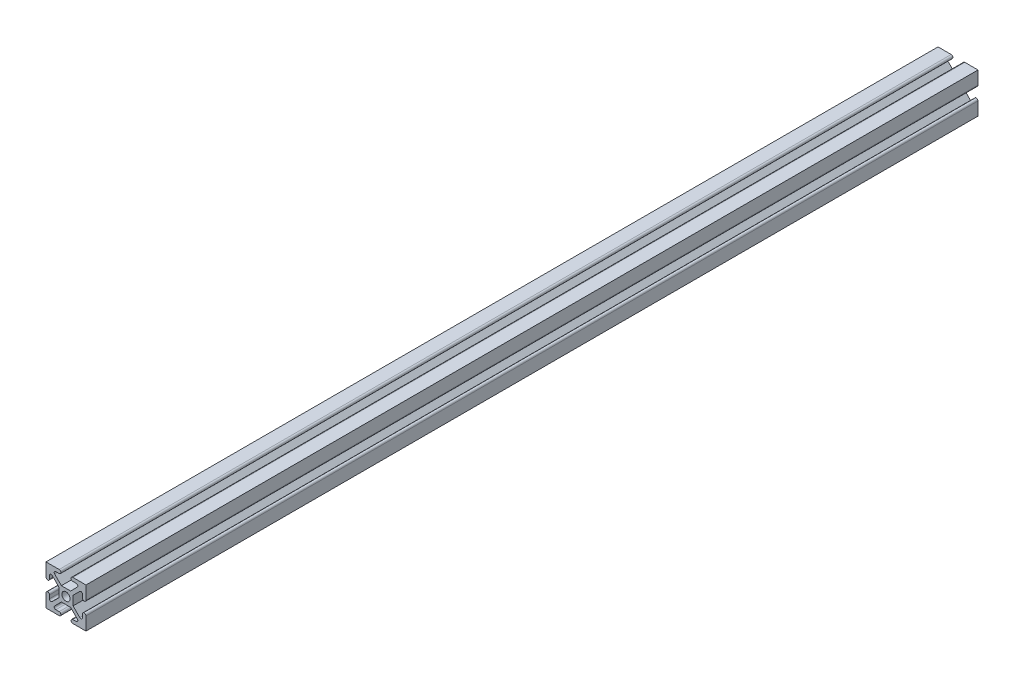
from build123d import *

# Parameters (mm, degrees)
SKETCH1_R           = 2.603515684
BOSS_EXTRUDE1_DEPTH = 566.7375


with BuildPart() as part:
    # Sketch1 → Boss-Extrude1 (new body)
    with BuildSketch(Plane.XY):
        with BuildLine():
            Line((-4.343426137, -10.490263197), (-6.474833462, -10.490263197))
            ThreePointArc((-6.474833462, -10.490263197), (-7.413500722, -9.863065786), (-7.19325828, -8.755832258))
            Line((-7.19325828, -8.755832258), (-2.933253106, -4.495827084))
            Line((-2.933253106, -4.495827084), (2.933253106, -4.495827084))
            Line((2.933253106, -4.495827084), (7.19325828, -8.755832258))
            ThreePointArc((7.19325828, -8.755832258), (7.413500722, -9.863065786), (6.474833462, -10.490263197))
            Line((6.474833462, -10.490263197), (4.343426166, -10.490263197))
            ThreePointArc((4.343426166, -10.490263197), (3.23851951, -11.595169853), (4.343426166, -12.700076509))
            Line((4.343426166, -12.700076509), (12.699923491, -12.700076509))
            Line((12.699923491, -12.700076509), (12.699923491, -4.343426137))
            ThreePointArc((12.699923491, -4.343426137), (11.595093344, -3.23859599), (10.490263197, -4.343426137))
            Line((10.490263197, -4.343426137), (10.490263197, -6.474986481))
            ThreePointArc((10.490263197, -6.474986481), (9.863065786, -7.413653741), (8.755832258, -7.193411299))
            Line((8.755832258, -7.193411299), (4.495827084, -2.933406125))
            Line((4.495827084, -2.933406125), (4.495827084, 2.933253106))
            Line((4.495827084, 2.933253106), (8.755832258, 7.19325828))
            ThreePointArc((8.755832258, 7.19325828), (9.863065786, 7.413500722), (10.490263197, 6.474833462))
            Line((10.490263197, 6.474833462), (10.490263197, 4.343426166))
            ThreePointArc((10.490263197, 4.343426166), (11.595169851, 3.238519512), (12.700076506, 4.343426166))
            Line((12.700076506, 4.343426166), (12.700076506, 12.699923491))
            Line((12.700076506, 12.699923491), (4.343426137, 12.699923491))
            ThreePointArc((4.343426137, 12.699923491), (3.238519481, 11.595016834), (4.343426137, 10.490110178))
            Line((4.343426137, 10.490110178), (6.474745748, 10.490110178))
            ThreePointArc((6.474745748, 10.490110178), (7.413388017, 9.862929465), (7.193151438, 8.755725417))
            Line((7.193151438, 8.755725417), (2.933100087, 4.495674066))
            Line((2.933100087, 4.495674066), (-2.933253106, 4.495674066))
            Line((-2.933253106, 4.495674066), (-7.19325828, 8.75567924))
            ThreePointArc((-7.19325828, 8.75567924), (-7.413500722, 9.862912767), (-6.474833462, 10.490110178))
            Line((-6.474833462, 10.490110178), (-4.343426166, 10.490110178))
            ThreePointArc((-4.343426166, 10.490110178), (-3.23851951, 11.595016834), (-4.343426166, 12.699923491))
            Line((-4.343426166, 12.699923491), (-12.700076509, 12.699923491))
            Line((-12.700076509, 12.699923491), (-12.700076509, 4.343426137))
            ThreePointArc((-12.700076509, 4.343426137), (-11.595169853, 3.238519481), (-10.490263197, 4.343426137))
            Line((-10.490263197, 4.343426137), (-10.490263197, 6.474833462))
            ThreePointArc((-10.490263197, 6.474833462), (-9.863065786, 7.413500722), (-8.755832258, 7.19325828))
            Line((-8.755832258, 7.19325828), (-4.495827084, 2.933253106))
            Line((-4.495827084, 2.933253106), (-4.495827084, -2.933253106))
            Line((-4.495827084, -2.933253106), (-8.755832258, -7.19325828))
            ThreePointArc((-8.755832258, -7.19325828), (-9.863065786, -7.413500722), (-10.490263197, -6.474833462))
            Line((-10.490263197, -6.474833462), (-10.490263197, -4.343426166))
            ThreePointArc((-10.490263197, -4.343426166), (-11.595169853, -3.23851951), (-12.700076509, -4.343426166))
            Line((-12.700076509, -4.343426166), (-12.700076509, -12.700076509))
            Line((-12.700076509, -12.700076509), (-4.343426137, -12.700076509))
            ThreePointArc((-4.343426137, -12.700076509), (-3.238519481, -11.595169853), (-4.343426137, -10.490263197))
        make_face()
        Circle(SKETCH1_R, mode=Mode.SUBTRACT)
    extrude(amount=-BOSS_EXTRUDE1_DEPTH)


solid = part.part
